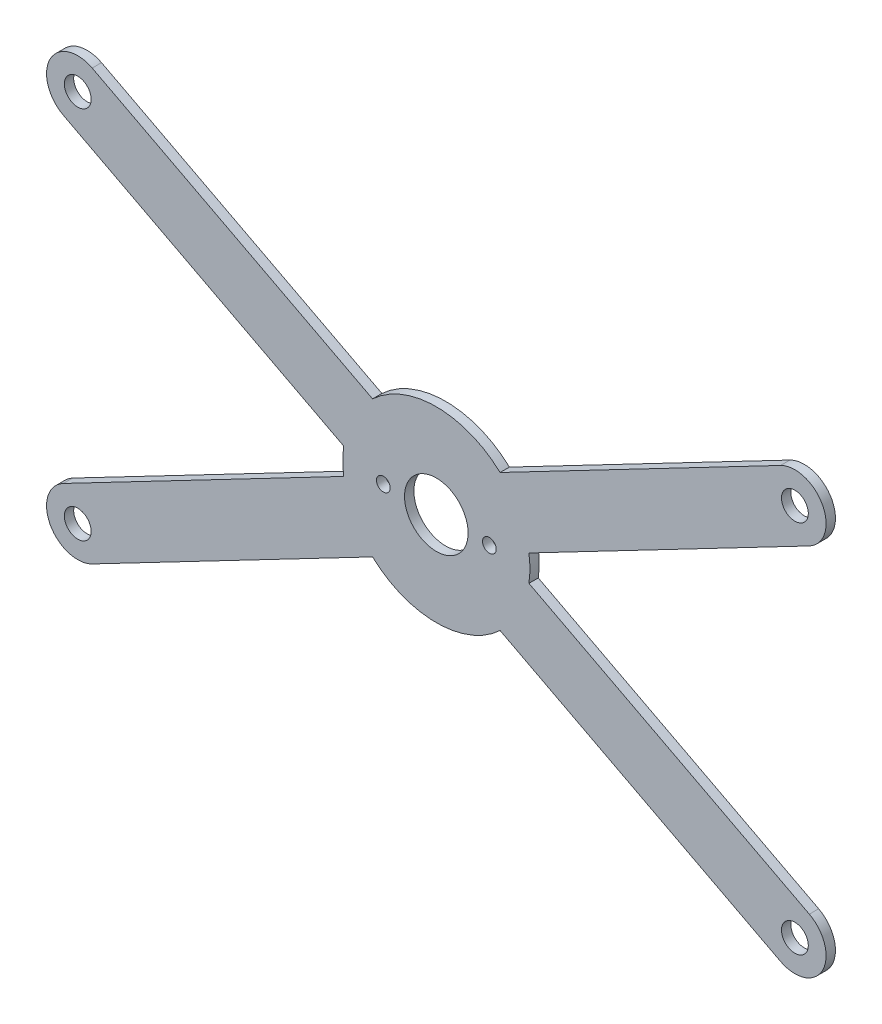
from build123d import *

# Parameters (mm, degrees)
SKETCH_1_R      = 2.15
SKETCH_1_R_2    = 1.1
SKETCH_1_R_3    = 5.1
EXTRUDE_1_DEPTH = 1.5


with BuildPart() as part:
    # ｽｹｯﾁ1 → ﾎﾞｽ - 押し出し1 (new body)
    with BuildSketch(Plane.XY):
        with BuildLine():
            Line((55.187169967, 34.432924231), (10.225373103, 10.974595432))
            ThreePointArc((10.225373103, 10.974595432), (0, 15), (-10.225373103, 10.974595432))
            Line((-10.225373103, 10.974595432), (-55.187169967, 34.432924231))
            ThreePointArc((-55.187169967, 34.432924231), (-61.932924231, 32.312830033), (-59.812830033, 25.567075769))
            Line((-59.812830033, 25.567075769), (-14.85103317, 2.108746971))
            ThreePointArc((-14.85103317, 2.108746971), (-15, 0), (-14.85103317, -2.108746971))
            Line((-14.85103317, -2.108746971), (-59.812830033, -25.567075769))
            ThreePointArc((-59.812830033, -25.567075769), (-61.932924231, -32.312830033), (-55.187169967, -34.432924231))
            Line((-55.187169967, -34.432924231), (-10.225373103, -10.974595432))
            ThreePointArc((-10.225373103, -10.974595432), (0, -15), (10.225373103, -10.974595432))
            Line((10.225373103, -10.974595432), (55.187169967, -34.432924231))
            ThreePointArc((55.187169967, -34.432924231), (61.932924231, -32.312830033), (59.812830033, -25.567075769))
            Line((59.812830033, -25.567075769), (14.85103317, -2.108746971))
            ThreePointArc((14.85103317, -2.108746971), (15, 0), (14.85103317, 2.108746971))
            Line((14.85103317, 2.108746971), (59.812830033, 25.567075769))
            ThreePointArc((59.812830033, 25.567075769), (61.932924231, 32.312830033), (55.187169967, 34.432924231))
        make_face()
        with Locations((-57.5, -30)):
            Circle(SKETCH_1_R, mode=Mode.SUBTRACT)
        with Locations((57.5, -30)):
            Circle(SKETCH_1_R, mode=Mode.SUBTRACT)
        with Locations((-8.5, 0)):
            Circle(SKETCH_1_R_2, mode=Mode.SUBTRACT)
        with Locations((-57.5, 30)):
            Circle(SKETCH_1_R, mode=Mode.SUBTRACT)
        Circle(SKETCH_1_R_3, mode=Mode.SUBTRACT)
        with Locations((8.5, 0)):
            Circle(SKETCH_1_R_2, mode=Mode.SUBTRACT)
        with Locations((57.5, 30)):
            Circle(SKETCH_1_R, mode=Mode.SUBTRACT)
    extrude(amount=EXTRUDE_1_DEPTH)


solid = part.part
